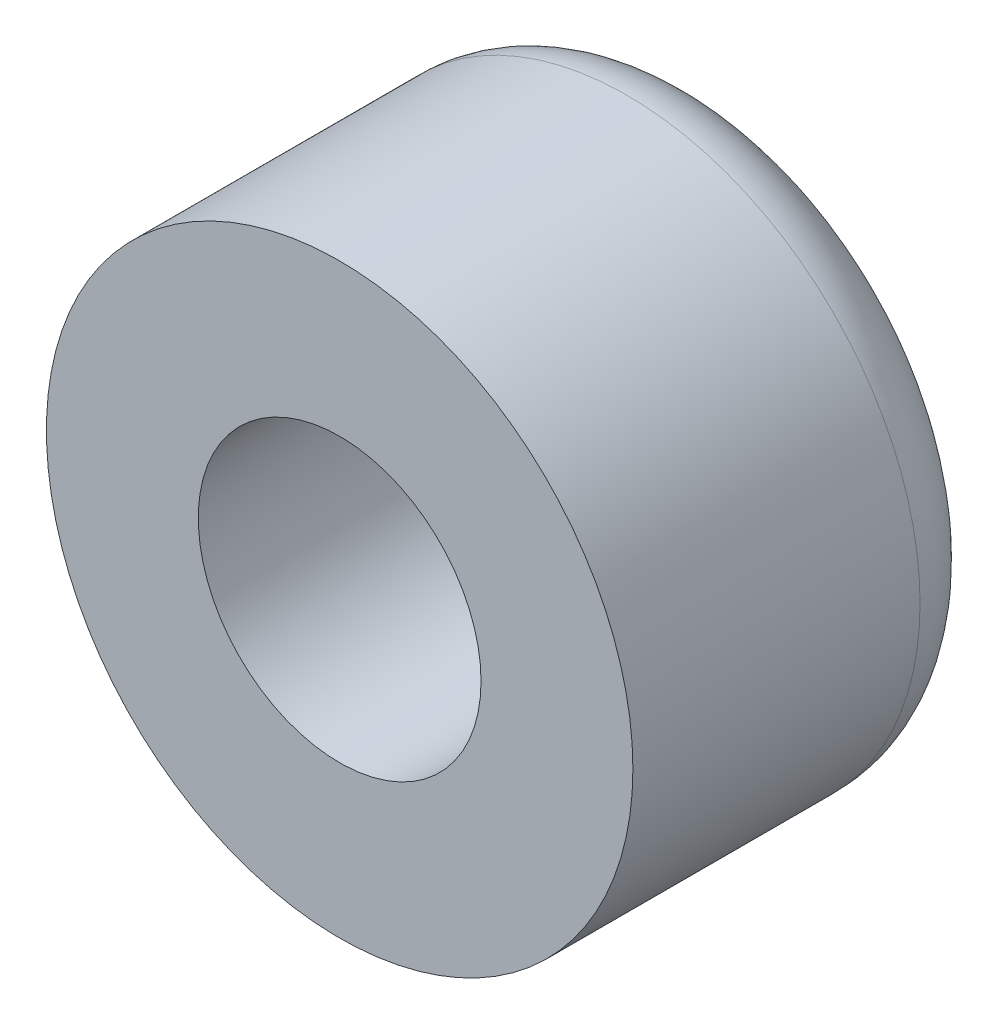
from build123d import *

# Parameters (mm, degrees)
CROQUIS2_R              = 12.6
CROQUIS2_R_2            = 6.075
SALIENTE_EXTRUIR1_DEPTH = 15.6
REDONDEO1_R             = 3.2625


with BuildPart() as part:
    # Croquis2 → Saliente-Extruir1 (new body)
    with BuildSketch(Plane.XY):
        Circle(CROQUIS2_R)
        Circle(CROQUIS2_R_2, mode=Mode.SUBTRACT)
    extrude(amount=-SALIENTE_EXTRUIR1_DEPTH)

    # Redondeo1
    redondeo1_edges = [part.edges().sort_by_distance(p)[0] for p in [
        (-6.075, 0, -15.6),
        (-12.6, 0, -15.6),
    ]]
    fillet(redondeo1_edges, radius=REDONDEO1_R - 0.0001)  # a hair under: the kernel refuses the full size


solid = part.part
